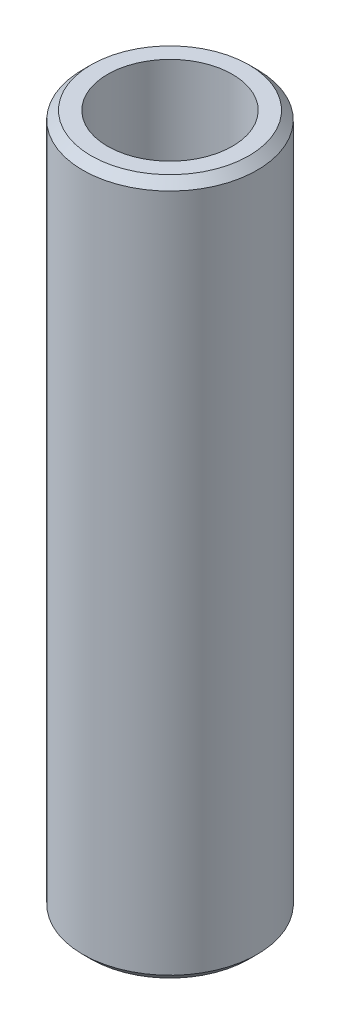
from build123d import *

# Parameters (mm, degrees)
SKETCH1_R           = 32.5
BOSS_EXTRUDE1_DEPTH = 259.335573331
SKETCH2_R           = 23.2555851
CUT_EXTRUDE1_DEPTH  = 264.376991392
CHAMFER1_SIZE       = 3.099531398


with BuildPart() as part:
    # Sketch1 → Boss-Extrude1 (new body)
    with BuildSketch(Plane(origin=(0, 0, 0), x_dir=(1, 0, 0), z_dir=(0, 1, 0))):
        Circle(SKETCH1_R)
    extrude(amount=BOSS_EXTRUDE1_DEPTH)

    # Sketch2 → Cut-Extrude1 (cut, through all)
    with BuildSketch(Plane(origin=(0, 0, 0), x_dir=(1, 0, 0), z_dir=(0, 1, 0))):
        Circle(SKETCH2_R)
    extrude(amount=CUT_EXTRUDE1_DEPTH, mode=Mode.SUBTRACT)

    # Chamfer1
    chamfer1_edges = [part.edges().sort_by_distance(p)[0] for p in [
        (-32.5, 259.335573331, 0),
        (-32.5, 0, 0),
    ]]
    chamfer(chamfer1_edges, length=CHAMFER1_SIZE)


solid = part.part
